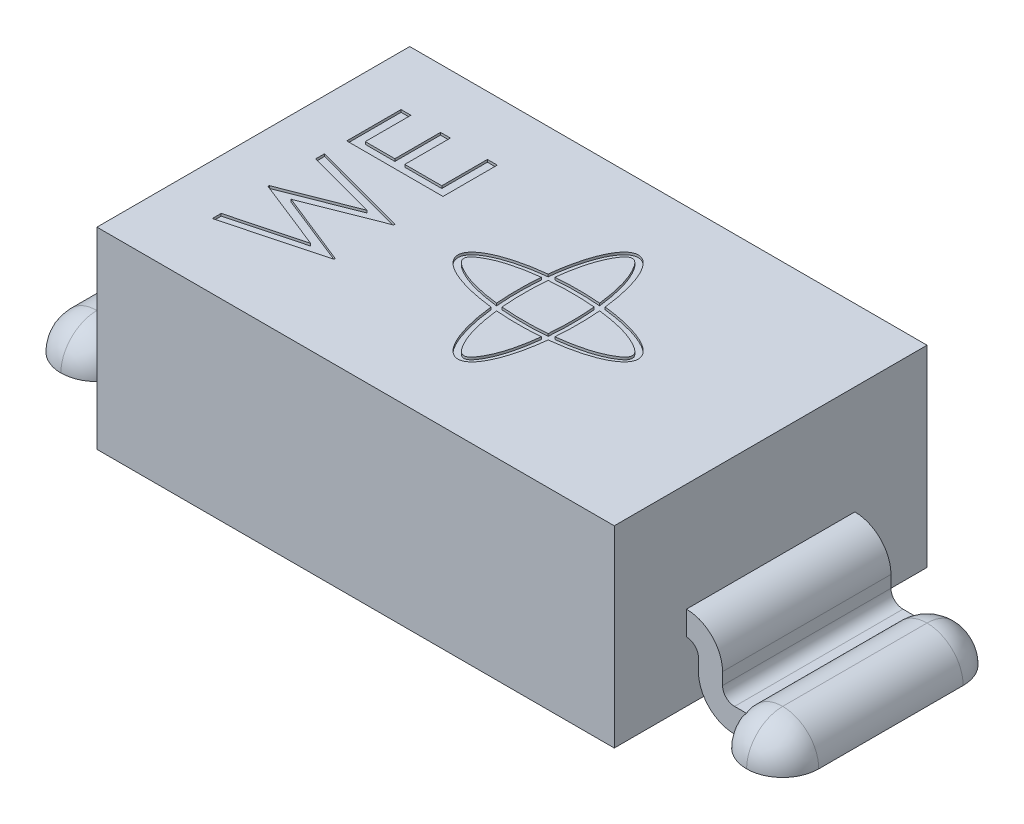
from build123d import *

# Parameters (mm, degrees)
CROQUIS1_W                 = 4.3
CROQUIS1_H                 = 2.6
SALIENTE_EXTRUIR1_DEPTH    = 1.6
CORTAR_EXTRUIR1_DEPTH      = 3.978674202
CORTAR_EXTRUIR1_DEPTH_BACK = 3.978674202
CROQUIS2_W                 = 1.4
CROQUIS2_H                 = 0.2
SALIENTE_EXTRUIR2_DEPTH    = 0.7
CROQUIS4_W                 = 0.6
CROQUIS4_H                 = 1.8
SALIENTE_EXTRUIR3_DEPTH    = 0.3
SALIENTE_EXTRUIR3_2_DEPTH  = 0.3
REDONDEO1_R                = 0.3
REDONDEO2_R                = 0.3
CORTAR_EXTRUIR2_DEPTH      = 0.7
CORTAR_EXTRUIR3_DEPTH      = 0.02


with BuildPart() as part:
    # Croquis1 → Saliente-Extruir1 (new body)
    with BuildSketch(Plane(origin=(0, 0, 0), x_dir=(1, 0, 0), z_dir=(0, 1, 0))):
        Rectangle(CROQUIS1_W, CROQUIS1_H)
    extrude(amount=SALIENTE_EXTRUIR1_DEPTH)

    # Croquis2 → Cortar-Extruir1 (cut, two sides: drawn at the far end of the back side and taken through both)
    with BuildSketch(Plane(origin=(0, 0, 0), x_dir=(0, 0, -1), z_dir=(1, 0, 0)).offset(-CORTAR_EXTRUIR1_DEPTH_BACK)):
        with Locations((0, 0.6)):
            Rectangle(CROQUIS2_W, CROQUIS2_H)
    extrude(amount=CORTAR_EXTRUIR1_DEPTH + CORTAR_EXTRUIR1_DEPTH_BACK, mode=Mode.SUBTRACT)

    # Croquis5 → Cortar-Extruir3 (cut)
    # profile 1 of 3: a face of its own
    with BuildSketch(Plane(origin=(0, 1.6, 0), x_dir=(1, 0, 0), z_dir=(0, 1, 0))):
        Polygon((-1.732487906, -0.758974359), (-1.732487906, -0.684775641), (-1.145789188, -0.528205128), (-1.732487906, -0.295352564), (-1.732487906, -0.284935897), (-1.149795599, -0.056410256), (-1.732487906, 0.100961538), (-1.732487906, 0.174358974), (-0.932487906, -0.041346154), (-0.932487906, -0.051602564), (-1.544346881, -0.292307692), (-0.932487906, -0.535897436), (-0.932487906, -0.546153846), align=None)
    # profile 2 of 3: a face of its own
    with BuildSketch(Plane(origin=(0, 1.6, 0), x_dir=(1, 0, 0), z_dir=(0, 1, 0))):
        Polygon((-1.732487906, 0.358974359), (-1.732487906, 0.81025641), (-1.650436624, 0.81025641), (-1.650436624, 0.430769231), (-1.404282778, 0.430769231), (-1.404282778, 0.81025641), (-1.322231496, 0.81025641), (-1.322231496, 0.430769231), (-1.014539188, 0.430769231), (-1.014539188, 0.81025641), (-0.932487906, 0.81025641), (-0.932487906, 0.358974359), align=None)
    # profile 3 of 3: a face of its own
    with BuildSketch(Plane(origin=(0, 1.6, 0), x_dir=(1, 0, 0), z_dir=(0, 1, 0))):
        with BuildLine():
            add(Edge.make_bspline(
                [(0.062829175, 0.237170825), (-2.071708245, 0), (0.062829175, -0.237170825)],
                knots=[5.034139535, 5.034139535, 5.034139535, 7.53223108, 7.53223108, 7.53223108], degree=2, weights=[1, 0.316227766, 1]))
            add(Edge.make_bspline(
                [(0.062829175, -0.237170825), (0.3, -2.371708245), (0.537170825, -0.237170825)],
                knots=[1.892546881, 1.892546881, 1.892546881, 4.390638426, 4.390638426, 4.390638426], degree=2, weights=[1, 0.316227766, 1]))
            add(Edge.make_bspline(
                [(0.537170825, -0.237170825), (2.671708245, 0), (0.537170825, 0.237170825)],
                knots=[1.892546881, 1.892546881, 1.892546881, 4.390638426, 4.390638426, 4.390638426], degree=2, weights=[1, 0.316227766, 1]))
            add(Edge.make_bspline(
                [(0.537170825, 0.237170825), (0.3, 2.371708245), (0.062829175, 0.237170825)],
                knots=[5.034139535, 5.034139535, 5.034139535, 7.53223108, 7.53223108, 7.53223108], degree=2, weights=[1, 0.316227766, 1]))
        make_face()
        with BuildLine():
            add(Edge.make_bspline(
                [(0.057833766, 0.186278386), (0.041910085, -3.2019e-05), (0.057838903, -0.186338473)],
                knots=[1.319797944, 1.319797944, 1.319797944, 1.821877418, 1.821877418, 1.821877418], degree=2, weights=[1, 0.968654663, 1]))
            add(Edge.make_bspline(
                [(0.057833766, 0.186278386), (0.032067809, 0.183269597), (-0.068861452, 0.169367723), (-0.236683418, 0.130350139), (-0.382867977, 0.051498217), (-0.408566012, 0), (-0.382867976, -0.051498216), (-0.222199355, -0.13816284), (-0.044879185, -0.174472148), (0.057838903, -0.186338473)],
                knots=[5.049350156, 5.049350156, 5.049350156, 5.049350156, 5.161459404, 5.497787144, 5.890486225, 6.283185307, 6.675884389, 7.068583471, 7.516052561, 7.516052561, 7.516052561, 7.516052561], degree=3))
        make_face(mode=Mode.SUBTRACT)
        with BuildLine():
            add(Edge.make_bspline(
                [(0.113661527, -0.242161097), (0.3, -0.258092653), (0.486338473, -0.242161097)],
                knots=[1.319715235, 1.319715235, 1.319715235, 1.821877418, 1.821877418, 1.821877418], degree=2, weights=[1, 0.968644389, 1]))
            add(Edge.make_bspline(
                [(0.113661527, -0.242161097), (0.125527851, -0.344879185), (0.16183716, -0.522199355), (0.248501783, -0.682867977), (0.3, -0.708566012), (0.351498217, -0.682867977), (0.43816284, -0.522199355), (0.474472149, -0.344879185), (0.486338473, -0.242161097)],
                knots=[1.9087254, 1.9087254, 1.9087254, 1.9087254, 2.35619449, 2.748893572, 3.141592654, 3.534291735, 3.926990817, 4.374459907, 4.374459907, 4.374459907, 4.374459907], degree=3))
        make_face(mode=Mode.SUBTRACT)
        with BuildLine():
            add(Edge.make_bspline(
                [(0.542161097, -0.186338472), (0.558092579, -8.57e-07), (0.542161235, 0.186336865)],
                knots=[4.46130789, 4.46130789, 4.46130789, 4.963467858, 4.963467858, 4.963467858], degree=2, weights=[1, 0.968644664, 1]))
            add(Edge.make_bspline(
                [(0.542161097, -0.186338472), (0.644879184, -0.174472148), (0.822199353, -0.138162839), (0.982867975, -0.051498216), (1.00856601, 0), (0.982867975, 0.051498217), (0.822209606, 0.13815731), (0.64491239, 0.174465349), (0.542161235, 0.186336865)],
                knots=[8.191910709, 8.191910709, 8.191910709, 8.191910709, 8.639379797, 9.032078879, 9.424777961, 9.817477042, 10.210176124, 10.657566543, 10.657566543, 10.657566543, 10.657566543], degree=3))
        make_face(mode=Mode.SUBTRACT)
        with BuildLine():
            add(Edge.make_bspline(
                [(0.486338473, 0.242161097), (0.3, 0.258092653), (0.113661527, 0.242161097)],
                knots=[4.461307889, 4.461307889, 4.461307889, 4.963470072, 4.963470072, 4.963470072], degree=2, weights=[1, 0.968644389, 1]))
            add(Edge.make_bspline(
                [(0.486338473, 0.242161097), (0.474472149, 0.344879185), (0.43816284, 0.522199355), (0.351498217, 0.682867976), (0.3, 0.708566012), (0.248501783, 0.682867976), (0.16183716, 0.522199355), (0.125527851, 0.344879185), (0.113661527, 0.242161097)],
                knots=[5.050318054, 5.050318054, 5.050318054, 5.050318054, 5.497787144, 5.890486225, 6.283185307, 6.675884389, 7.068583471, 7.51605256, 7.51605256, 7.51605256, 7.51605256], degree=3))
        make_face(mode=Mode.SUBTRACT)
        with BuildLine():
            add(Edge.make_bspline(
                [(0.108477062, -0.191522938), (0.170795345, -0.197103573), (0.3, -0.202896426), (0.429204654, -0.197103573), (0.491522938, -0.191522938)],
                knots=[7.588701487, 7.588701487, 7.588701487, 7.588701487, 7.853981634, 8.119261784, 8.119261784, 8.119261784, 8.119261784], degree=3))
            add(Edge.make_bspline(
                [(0.491522938, -0.191522938), (0.497103574, -0.129204654), (0.502896422, -1.03e-07), (0.497103583, 0.129204447), (0.491522965, 0.191522639)],
                knots=[4.447108833, 4.447108833, 4.447108833, 4.447108833, 4.71238898, 4.977668703, 4.977668703, 4.977668703, 4.977668703], degree=3))
            add(Edge.make_bspline(
                [(0.491522965, 0.191522639), (0.429135158, 0.197111973), (0.30962563, 0.20247756), (0.180349619, 0.197596289), (0.117785716, 0.192367081), (0.108477136, 0.191523765)],
                knots=[10.730173702, 10.730173702, 10.730173702, 10.730173702, 10.995574288, 11.220426218, 11.259985329, 11.259985329, 11.259985329, 11.259985329], degree=3))
            add(Edge.make_bspline(
                [(0.108477136, 0.191523765), (0.102896452, 0.129205225), (0.097103561, 2.86e-07), (0.102896426, -0.129204654), (0.108477062, -0.191522938)],
                knots=[1.305515006, 1.305515006, 1.305515006, 1.305515006, 1.570796327, 1.836076474, 1.836076474, 1.836076474, 1.836076474], degree=3))
        make_face(mode=Mode.SUBTRACT)
    extrude(amount=-CORTAR_EXTRUIR3_DEPTH, mode=Mode.SUBTRACT)


with BuildPart() as body_2:
    # Croquis3 → Saliente-Extruir2 (new, symmetric)
    with BuildSketch(Plane.XY):
        with BuildLine():
            Line((2.15, 0.5), (-2.15, 0.5))
            ThreePointArc((-2.15, 0.5), (-2.220710678, 0.470710678), (-2.25, 0.4))
            Line((-2.25, 0.4), (-2.25, 0.3))
            ThreePointArc((-2.25, 0.3), (-2.337867966, 0.087867966), (-2.55, 0))
            Line((-2.55, 0), (-3, 0))
            Line((-3, 0), (-3, 0.2))
            Line((-3, 0.2), (-2.55, 0.2))
            ThreePointArc((-2.55, 0.2), (-2.479289322, 0.229289322), (-2.45, 0.3))
            Line((-2.45, 0.3), (-2.45, 0.4))
            ThreePointArc((-2.45, 0.4), (-2.362132034, 0.612132034), (-2.15, 0.7))
            Line((-2.15, 0.7), (2.15, 0.7))
            ThreePointArc((2.15, 0.7), (2.362132034, 0.612132034), (2.45, 0.4))
            Line((2.45, 0.4), (2.45, 0.3))
            ThreePointArc((2.45, 0.3), (2.479289322, 0.229289322), (2.55, 0.2))
            Line((2.55, 0.2), (3, 0.2))
            Line((3, 0.2), (3, 0))
            Line((3, 0), (2.55, 0))
            ThreePointArc((2.55, 0), (2.337867966, 0.087867966), (2.25, 0.3))
            Line((2.25, 0.3), (2.25, 0.4))
            ThreePointArc((2.25, 0.4), (2.220710678, 0.470710678), (2.15, 0.5))
        make_face()
    extrude(amount=SALIENTE_EXTRUIR2_DEPTH, both=True)


with BuildPart() as body_3:
    # Croquis4 → Saliente-Extruir3 (new body)
    with BuildSketch(Plane(origin=(0, 0, 0), x_dir=(1, 0, 0), z_dir=(0, 1, 0))):
        with Locations((-2.85, 0)):
            Rectangle(CROQUIS4_W, CROQUIS4_H)
    extrude(amount=SALIENTE_EXTRUIR3_DEPTH)

    # Redondeo1
    # the kernel refuses this fillet: 0.3 mm, written as the material it takes off along each edge
    with BuildSketch(Plane(origin=(-1.8, 0.3, -0.9), x_dir=(0, -1, 0), z_dir=(-1, 0, 0))) as redondeo1_piece_1:
        with BuildLine():
            CenterArc((REDONDEO1_R, REDONDEO1_R), REDONDEO1_R, 180, 90)
            Line((0, REDONDEO1_R), (-REDONDEO1_R * 0.02, REDONDEO1_R))
            Line((-REDONDEO1_R * 0.02, REDONDEO1_R), (-REDONDEO1_R * 0.02, -REDONDEO1_R * 0.02))
            Line((-REDONDEO1_R * 0.02, -REDONDEO1_R * 0.02), (REDONDEO1_R, -REDONDEO1_R * 0.02))
            Line((REDONDEO1_R, -REDONDEO1_R * 0.02), (REDONDEO1_R, 0))
        make_face()
    extrude(amount=2.1, mode=Mode.SUBTRACT)
    # the kernel refuses this fillet: 0.3 mm, written as the material it takes off along each edge
    with BuildSketch(Plane(origin=(-3.15, 0.3, -0.6), x_dir=(0, -1, 0), z_dir=(0, 0, 1))) as redondeo1_2_piece_1:
        with BuildLine():
            CenterArc((REDONDEO1_R, REDONDEO1_R), REDONDEO1_R, 180, 90)
            Line((0, REDONDEO1_R), (-REDONDEO1_R * 0.02, REDONDEO1_R))
            Line((-REDONDEO1_R * 0.02, REDONDEO1_R), (-REDONDEO1_R * 0.02, -REDONDEO1_R * 0.02))
            Line((-REDONDEO1_R * 0.02, -REDONDEO1_R * 0.02), (REDONDEO1_R, -REDONDEO1_R * 0.02))
            Line((REDONDEO1_R, -REDONDEO1_R * 0.02), (REDONDEO1_R, 0))
        make_face()
    extrude(amount=2.25, mode=Mode.SUBTRACT)
    with BuildSketch(Plane(origin=(-3.15, 0, -0.6), x_dir=(0, -0.5976672776328278, 0.801744239297648), z_dir=(0, 0.801744239297648, 0.5976672776328278))) as redondeo1_2_piece_2:
        with BuildLine():
            CenterArc((0.3 - REDONDEO1_R, REDONDEO1_R), REDONDEO1_R, 270, 90)
            Line((0.3 - REDONDEO1_R, 0), (0.3 - REDONDEO1_R, -REDONDEO1_R * 0.02))
            Line((0.3 - REDONDEO1_R, -REDONDEO1_R * 0.02), (0.3 + REDONDEO1_R * 0.02, -REDONDEO1_R * 0.02))
            Line((0.3 + REDONDEO1_R * 0.02, -REDONDEO1_R * 0.02), (0.3 + REDONDEO1_R * 0.02, REDONDEO1_R))
            Line((0.3 + REDONDEO1_R * 0.02, REDONDEO1_R), (0.3, REDONDEO1_R))
        make_face()
    revolve(axis=Axis((-3.15, 0, -0.6), (1, 0, 0)), revolution_arc=233.296989237, mode=Mode.SUBTRACT)
    # the kernel refuses this fillet: 0.3 mm, written as the material it takes off along each edge
    with BuildSketch(Plane(origin=(-2.85, 0.3, 0.9), x_dir=(0, -1, 0), z_dir=(1, 0, 0))) as redondeo1_3_piece_1:
        with BuildLine():
            CenterArc((REDONDEO1_R, REDONDEO1_R), REDONDEO1_R, 180, 90)
            Line((0, REDONDEO1_R), (-REDONDEO1_R * 0.02, REDONDEO1_R))
            Line((-REDONDEO1_R * 0.02, REDONDEO1_R), (-REDONDEO1_R * 0.02, -REDONDEO1_R * 0.02))
            Line((-REDONDEO1_R * 0.02, -REDONDEO1_R * 0.02), (REDONDEO1_R, -REDONDEO1_R * 0.02))
            Line((REDONDEO1_R, -REDONDEO1_R * 0.02), (REDONDEO1_R, 0))
        make_face()
    extrude(amount=1.05, mode=Mode.SUBTRACT)
    with BuildSketch(Plane(origin=(-2.85, 0, 0.9), x_dir=(0.8017442392976477, -0.597667277632828, 0), z_dir=(0.597667277632828, 0.8017442392976477, 0))) as redondeo1_3_piece_2:
        with BuildLine():
            CenterArc((0.3 - REDONDEO1_R, REDONDEO1_R), REDONDEO1_R, 270, 90)
            Line((0.3, REDONDEO1_R), (0.3 + REDONDEO1_R * 0.02, REDONDEO1_R))
            Line((0.3 + REDONDEO1_R * 0.02, REDONDEO1_R), (0.3 + REDONDEO1_R * 0.02, -REDONDEO1_R * 0.02))
            Line((0.3 + REDONDEO1_R * 0.02, -REDONDEO1_R * 0.02), (0.3 - REDONDEO1_R, -REDONDEO1_R * 0.02))
            Line((0.3 - REDONDEO1_R, -REDONDEO1_R * 0.02), (0.3 - REDONDEO1_R, 0))
        make_face()
    revolve(axis=Axis((-2.85, 0, 0.9), (0, 0, -1)), revolution_arc=233.296989237, mode=Mode.SUBTRACT)
    # the kernel refuses this fillet: 0.3 mm, written as the material it takes off along each edge
    with BuildSketch(Plane(origin=(-2.55, 0.3, 0.6), x_dir=(0, -1, 0), z_dir=(0, 0, -1))) as redondeo1_4_piece_1:
        with BuildLine():
            CenterArc((REDONDEO1_R, REDONDEO1_R), REDONDEO1_R, 180, 90)
            Line((0, REDONDEO1_R), (-REDONDEO1_R * 0.02, REDONDEO1_R))
            Line((-REDONDEO1_R * 0.02, REDONDEO1_R), (-REDONDEO1_R * 0.02, -REDONDEO1_R * 0.02))
            Line((-REDONDEO1_R * 0.02, -REDONDEO1_R * 0.02), (REDONDEO1_R, -REDONDEO1_R * 0.02))
            Line((REDONDEO1_R, -REDONDEO1_R * 0.02), (REDONDEO1_R, 0))
        make_face()
    extrude(amount=1.2, mode=Mode.SUBTRACT)
    with BuildSketch(Plane(origin=(-2.55, 0, 0.6), x_dir=(0, -0.5976672776328278, -0.801744239297648), z_dir=(0, 0.801744239297648, -0.5976672776328278))) as redondeo1_4_piece_2:
        with BuildLine():
            CenterArc((0.3 - REDONDEO1_R, REDONDEO1_R), REDONDEO1_R, 270, 90)
            Line((0.3 - REDONDEO1_R, 0), (0.3 - REDONDEO1_R, -REDONDEO1_R * 0.02))
            Line((0.3 - REDONDEO1_R, -REDONDEO1_R * 0.02), (0.3 + REDONDEO1_R * 0.02, -REDONDEO1_R * 0.02))
            Line((0.3 + REDONDEO1_R * 0.02, -REDONDEO1_R * 0.02), (0.3 + REDONDEO1_R * 0.02, REDONDEO1_R))
            Line((0.3 + REDONDEO1_R * 0.02, REDONDEO1_R), (0.3, REDONDEO1_R))
        make_face()
    revolve(axis=Axis((-2.55, 0, 0.6), (-1, 0, 0)), revolution_arc=233.296989237, mode=Mode.SUBTRACT)
    with BuildSketch(Plane(origin=(-2.55, 0, -0.6), x_dir=(0, -0.597667277632826, 0.8017442392976493), z_dir=(0, 0.8017442392976493, 0.597667277632826))) as redondeo1_4_piece_3:
        with BuildLine():
            CenterArc((0.3 - REDONDEO1_R, -REDONDEO1_R), REDONDEO1_R, 0, 90)
            Line((0.3 - REDONDEO1_R, 0), (0.3 - REDONDEO1_R, REDONDEO1_R * 0.02))
            Line((0.3 - REDONDEO1_R, REDONDEO1_R * 0.02), (0.3 + REDONDEO1_R * 0.02, REDONDEO1_R * 0.02))
            Line((0.3 + REDONDEO1_R * 0.02, REDONDEO1_R * 0.02), (0.3 + REDONDEO1_R * 0.02, -REDONDEO1_R))
            Line((0.3 + REDONDEO1_R * 0.02, -REDONDEO1_R), (0.3, -REDONDEO1_R))
        make_face()
    revolve(axis=Axis((-2.55, 0, -0.6), (1, 0, 0)), revolution_arc=233.296989237, mode=Mode.SUBTRACT)


with BuildPart() as body_4:
    # Croquis4 → Saliente-Extruir3 2 (new body)
    with BuildSketch(Plane(origin=(0, 0, 0), x_dir=(1, 0, 0), z_dir=(0, 1, 0))):
        with Locations((2.85, 0)):
            Rectangle(CROQUIS4_W, CROQUIS4_H)
    extrude(amount=SALIENTE_EXTRUIR3_2_DEPTH)

    # Redondeo2
    # the kernel refuses this fillet: 0.3 mm, written as the material it takes off along each edge
    with BuildSketch(Plane(origin=(1.8, 0.3, 0.9), x_dir=(0, -1, 0), z_dir=(1, 0, 0))) as redondeo2_piece_1:
        with BuildLine():
            CenterArc((REDONDEO2_R, REDONDEO2_R), REDONDEO2_R, 180, 90)
            Line((0, REDONDEO2_R), (-REDONDEO2_R * 0.02, REDONDEO2_R))
            Line((-REDONDEO2_R * 0.02, REDONDEO2_R), (-REDONDEO2_R * 0.02, -REDONDEO2_R * 0.02))
            Line((-REDONDEO2_R * 0.02, -REDONDEO2_R * 0.02), (REDONDEO2_R, -REDONDEO2_R * 0.02))
            Line((REDONDEO2_R, -REDONDEO2_R * 0.02), (REDONDEO2_R, 0))
        make_face()
    extrude(amount=2.1, mode=Mode.SUBTRACT)
    # the kernel refuses this fillet: 0.3 mm, written as the material it takes off along each edge
    with BuildSketch(Plane(origin=(3.15, 0.3, 0.6), x_dir=(0, -1, 0), z_dir=(0, 0, -1))) as redondeo2_2_piece_1:
        with BuildLine():
            CenterArc((REDONDEO2_R, REDONDEO2_R), REDONDEO2_R, 180, 90)
            Line((0, REDONDEO2_R), (-REDONDEO2_R * 0.02, REDONDEO2_R))
            Line((-REDONDEO2_R * 0.02, REDONDEO2_R), (-REDONDEO2_R * 0.02, -REDONDEO2_R * 0.02))
            Line((-REDONDEO2_R * 0.02, -REDONDEO2_R * 0.02), (REDONDEO2_R, -REDONDEO2_R * 0.02))
            Line((REDONDEO2_R, -REDONDEO2_R * 0.02), (REDONDEO2_R, 0))
        make_face()
    extrude(amount=2.25, mode=Mode.SUBTRACT)
    with BuildSketch(Plane(origin=(3.15, 0, 0.6), x_dir=(0, -0.5976672776328283, -0.8017442392976475), z_dir=(0, 0.8017442392976475, -0.5976672776328283))) as redondeo2_2_piece_2:
        with BuildLine():
            CenterArc((0.3 - REDONDEO2_R, REDONDEO2_R), REDONDEO2_R, 270, 90)
            Line((0.3 - REDONDEO2_R, 0), (0.3 - REDONDEO2_R, -REDONDEO2_R * 0.02))
            Line((0.3 - REDONDEO2_R, -REDONDEO2_R * 0.02), (0.3 + REDONDEO2_R * 0.02, -REDONDEO2_R * 0.02))
            Line((0.3 + REDONDEO2_R * 0.02, -REDONDEO2_R * 0.02), (0.3 + REDONDEO2_R * 0.02, REDONDEO2_R))
            Line((0.3 + REDONDEO2_R * 0.02, REDONDEO2_R), (0.3, REDONDEO2_R))
        make_face()
    revolve(axis=Axis((3.15, 0, 0.6), (-1, 0, 0)), revolution_arc=233.296989237, mode=Mode.SUBTRACT)
    # the kernel refuses this fillet: 0.3 mm, written as the material it takes off along each edge
    with BuildSketch(Plane(origin=(2.85, 0.3, -0.9), x_dir=(0, -1, 0), z_dir=(-1, 0, 0))) as redondeo2_3_piece_1:
        with BuildLine():
            CenterArc((REDONDEO2_R, REDONDEO2_R), REDONDEO2_R, 180, 90)
            Line((0, REDONDEO2_R), (-REDONDEO2_R * 0.02, REDONDEO2_R))
            Line((-REDONDEO2_R * 0.02, REDONDEO2_R), (-REDONDEO2_R * 0.02, -REDONDEO2_R * 0.02))
            Line((-REDONDEO2_R * 0.02, -REDONDEO2_R * 0.02), (REDONDEO2_R, -REDONDEO2_R * 0.02))
            Line((REDONDEO2_R, -REDONDEO2_R * 0.02), (REDONDEO2_R, 0))
        make_face()
    extrude(amount=1.05, mode=Mode.SUBTRACT)
    with BuildSketch(Plane(origin=(2.85, 0, -0.9), x_dir=(-0.8017442392976477, -0.597667277632828, 0), z_dir=(-0.597667277632828, 0.8017442392976477, 0))) as redondeo2_3_piece_2:
        with BuildLine():
            CenterArc((0.3 - REDONDEO2_R, REDONDEO2_R), REDONDEO2_R, 270, 90)
            Line((0.3, REDONDEO2_R), (0.3 + REDONDEO2_R * 0.02, REDONDEO2_R))
            Line((0.3 + REDONDEO2_R * 0.02, REDONDEO2_R), (0.3 + REDONDEO2_R * 0.02, -REDONDEO2_R * 0.02))
            Line((0.3 + REDONDEO2_R * 0.02, -REDONDEO2_R * 0.02), (0.3 - REDONDEO2_R, -REDONDEO2_R * 0.02))
            Line((0.3 - REDONDEO2_R, -REDONDEO2_R * 0.02), (0.3 - REDONDEO2_R, 0))
        make_face()
    revolve(axis=Axis((2.85, 0, -0.9), (0, 0, 1)), revolution_arc=233.296989237, mode=Mode.SUBTRACT)
    # the kernel refuses this fillet: 0.3 mm, written as the material it takes off along each edge
    with BuildSketch(Plane(origin=(2.55, 0.3, -0.6), x_dir=(0, -1, 0), z_dir=(0, 0, 1))) as redondeo2_4_piece_1:
        with BuildLine():
            CenterArc((REDONDEO2_R, REDONDEO2_R), REDONDEO2_R, 180, 90)
            Line((0, REDONDEO2_R), (-REDONDEO2_R * 0.02, REDONDEO2_R))
            Line((-REDONDEO2_R * 0.02, REDONDEO2_R), (-REDONDEO2_R * 0.02, -REDONDEO2_R * 0.02))
            Line((-REDONDEO2_R * 0.02, -REDONDEO2_R * 0.02), (REDONDEO2_R, -REDONDEO2_R * 0.02))
            Line((REDONDEO2_R, -REDONDEO2_R * 0.02), (REDONDEO2_R, 0))
        make_face()
    extrude(amount=1.2, mode=Mode.SUBTRACT)
    with BuildSketch(Plane(origin=(2.55, 0, -0.6), x_dir=(0, -0.5976672776328263, 0.8017442392976492), z_dir=(0, 0.8017442392976492, 0.5976672776328263))) as redondeo2_4_piece_2:
        with BuildLine():
            CenterArc((0.3 - REDONDEO2_R, REDONDEO2_R), REDONDEO2_R, 270, 90)
            Line((0.3 - REDONDEO2_R, 0), (0.3 - REDONDEO2_R, -REDONDEO2_R * 0.02))
            Line((0.3 - REDONDEO2_R, -REDONDEO2_R * 0.02), (0.3 + REDONDEO2_R * 0.02, -REDONDEO2_R * 0.02))
            Line((0.3 + REDONDEO2_R * 0.02, -REDONDEO2_R * 0.02), (0.3 + REDONDEO2_R * 0.02, REDONDEO2_R))
            Line((0.3 + REDONDEO2_R * 0.02, REDONDEO2_R), (0.3, REDONDEO2_R))
        make_face()
    revolve(axis=Axis((2.55, 0, -0.6), (1, 0, 0)), revolution_arc=233.296989237, mode=Mode.SUBTRACT)
    with BuildSketch(Plane(origin=(2.55, 0, 0.6), x_dir=(0, -0.5976672776328273, -0.8017442392976484), z_dir=(0, 0.8017442392976484, -0.5976672776328273))) as redondeo2_4_piece_3:
        with BuildLine():
            CenterArc((0.3 - REDONDEO2_R, -REDONDEO2_R), REDONDEO2_R, 0, 90)
            Line((0.3 - REDONDEO2_R, 0), (0.3 - REDONDEO2_R, REDONDEO2_R * 0.02))
            Line((0.3 - REDONDEO2_R, REDONDEO2_R * 0.02), (0.3 + REDONDEO2_R * 0.02, REDONDEO2_R * 0.02))
            Line((0.3 + REDONDEO2_R * 0.02, REDONDEO2_R * 0.02), (0.3 + REDONDEO2_R * 0.02, -REDONDEO2_R))
            Line((0.3 + REDONDEO2_R * 0.02, -REDONDEO2_R), (0.3, -REDONDEO2_R))
        make_face()
    revolve(axis=Axis((2.55, 0, 0.6), (-1, 0, 0)), revolution_arc=233.296989237, mode=Mode.SUBTRACT)


with BuildPart() as cortar_extruir2_tool:
    # Croquis3<2> → Cortar-Extruir2 (new, symmetric)
    with BuildSketch(Plane.XY):
        with BuildLine():
            Line((2.15, 0.5), (-2.15, 0.5))
            ThreePointArc((-2.15, 0.5), (-2.220710678, 0.470710678), (-2.25, 0.4))
            Line((-2.25, 0.4), (-2.25, 0.3))
            ThreePointArc((-2.25, 0.3), (-2.337867966, 0.087867966), (-2.55, 0))
            Line((-2.55, 0), (-3, 0))
            Line((-3, 0), (-3, 0.2))
            Line((-3, 0.2), (-2.55, 0.2))
            ThreePointArc((-2.55, 0.2), (-2.479289322, 0.229289322), (-2.45, 0.3))
            Line((-2.45, 0.3), (-2.45, 0.4))
            ThreePointArc((-2.45, 0.4), (-2.362132034, 0.612132034), (-2.15, 0.7))
            Line((-2.15, 0.7), (2.15, 0.7))
            ThreePointArc((2.15, 0.7), (2.362132034, 0.612132034), (2.45, 0.4))
            Line((2.45, 0.4), (2.45, 0.3))
            ThreePointArc((2.45, 0.3), (2.479289322, 0.229289322), (2.55, 0.2))
            Line((2.55, 0.2), (3, 0.2))
            Line((3, 0.2), (3, 0))
            Line((3, 0), (2.55, 0))
            ThreePointArc((2.55, 0), (2.337867966, 0.087867966), (2.25, 0.3))
            Line((2.25, 0.3), (2.25, 0.4))
            ThreePointArc((2.25, 0.4), (2.220710678, 0.470710678), (2.15, 0.5))
        make_face()
    extrude(amount=CORTAR_EXTRUIR2_DEPTH, both=True)


with BuildPart() as body_3_1:
    add(body_3.part)

    # Cortar-Extruir2: cut by cortar_extruir2_tool
    add(cortar_extruir2_tool.part, mode=Mode.SUBTRACT)


with BuildPart() as body_4_1:
    add(body_4.part)

    # Cortar-Extruir2: cut by cortar_extruir2_tool
    add(cortar_extruir2_tool.part, mode=Mode.SUBTRACT)


solid = Compound([part.part, body_2.part, body_3_1.part, body_4_1.part])
